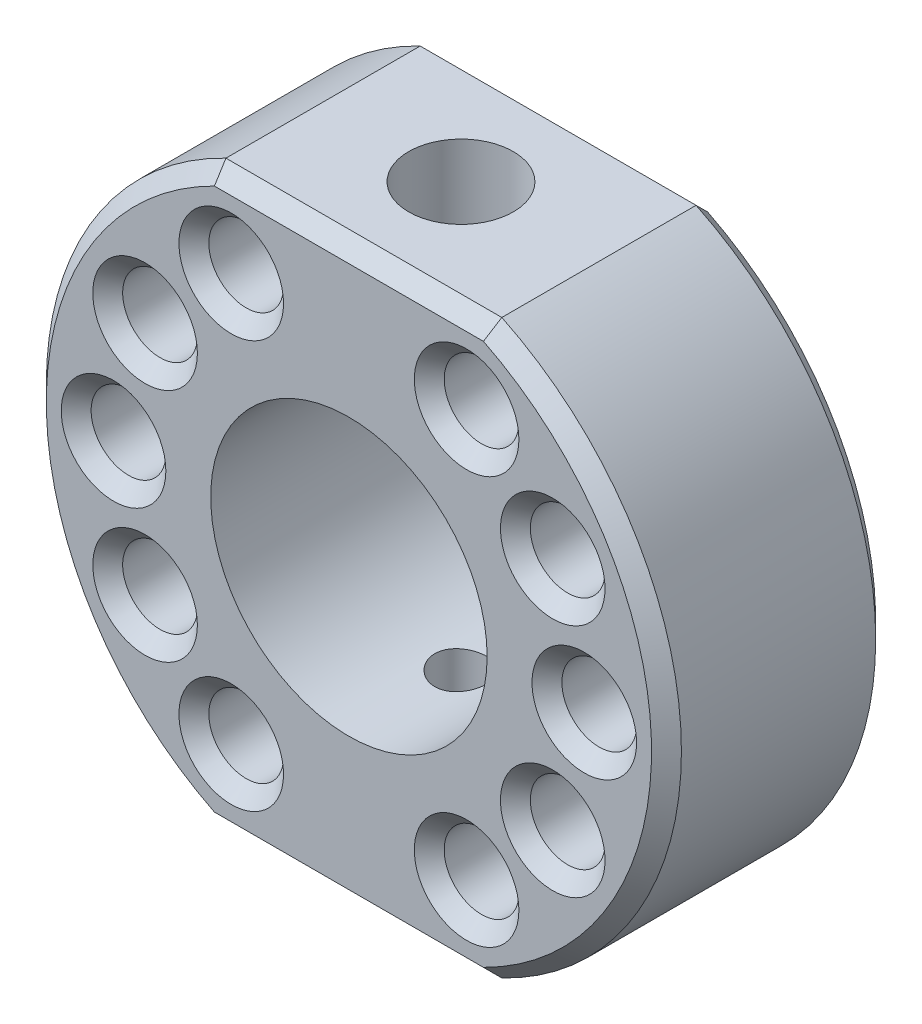
from build123d import *

# Parameters (mm, degrees)
SKETCH_1_R          = 21.25
SKETCH_1_R_2        = 9.25
SKETCH_1_R_3        = 2.5
EXTRUDE_1_DEPTH     = 15
CUT_EXTRUDE_START   = -15
CUT_EXTRUDE_1_DEPTH = 15
SKETCH_3_R          = 1.75
CUT_EXTRUDE_2_DEPTH = 47.280726062
CHAMFER_1_SIZE      = 1
CHAMFER_2_SIZE      = 1
SKETCH_4_R          = 3.5
CUT_EXTRUDE_3_DEPTH = 5


# Read off the part's stored shape, not the designer's step: ｶｯﾄ - 押し出し1
with BuildPart() as part:
    # ｽｹｯﾁ1 → ﾎﾞｽ - 押し出し1 (new body)
    with BuildSketch(Plane.XY):
        Circle(SKETCH_1_R)
        Circle(SKETCH_1_R_2, mode=Mode.SUBTRACT)
        with Locations((15.75, 0)):
            Circle(SKETCH_1_R_3, mode=Mode.SUBTRACT)
        with Locations((13.63990011, -7.875)):
            Circle(SKETCH_1_R_3, mode=Mode.SUBTRACT)
        with Locations((7.875, -13.63990011)):
            Circle(SKETCH_1_R_3, mode=Mode.SUBTRACT)
        with Locations(Location((7.875, 13.63990011, 0), (0, 0, 180))):
            Circle(SKETCH_1_R_3, mode=Mode.SUBTRACT)
        with Locations(Location((13.63990011, 7.875, 0), (0, 0, 180))):
            Circle(SKETCH_1_R_3, mode=Mode.SUBTRACT)
        with Locations(Location((-7.875, -13.63990011, 0), (0, 0, 180))):
            Circle(SKETCH_1_R_3, mode=Mode.SUBTRACT)
        with Locations(Location((-13.63990011, -7.875, 0), (0, 0, 180))):
            Circle(SKETCH_1_R_3, mode=Mode.SUBTRACT)
        with Locations(Location((-15.75, 0, 0), (0, 0, 180))):
            Circle(SKETCH_1_R_3, mode=Mode.SUBTRACT)
        with Locations((-13.63990011, 7.875)):
            Circle(SKETCH_1_R_3, mode=Mode.SUBTRACT)
        with Locations((-7.875, 13.63990011)):
            Circle(SKETCH_1_R_3, mode=Mode.SUBTRACT)
    extrude(amount=EXTRUDE_1_DEPTH)

    # ｶｯﾄ - 押し出し1 outline → ｶｯﾄ - 押し出し1 (cut)
    with BuildSketch(Plane.XY.offset(15).offset(CUT_EXTRUDE_START)):
        with BuildLine():
            Line((-9.231832093, 19.13990011), (9.231832093, 19.13990011))
            ThreePointArc((9.231832093, 19.13990011), (0, 21.25), (-9.231832093, 19.13990011))
        make_face()
        with BuildLine():
            Line((9.231832093, -19.13990011), (-9.231832093, -19.13990011))
            ThreePointArc((-9.231832093, -19.13990011), (0, -21.25), (9.231832093, -19.13990011))
        make_face()
    extrude(amount=CUT_EXTRUDE_1_DEPTH, mode=Mode.SUBTRACT)

    # ｽｹｯﾁ3 → ｶｯﾄ - 押し出し2 (cut, through all)
    with BuildSketch(Plane(origin=(0, 19.13990011, 0), x_dir=(1, 0, 0), z_dir=(0, 1, 0))):
        with Locations(Location((0, -7.5, 0), (0, 0, 270))):
            Circle(SKETCH_3_R)
    extrude(amount=-CUT_EXTRUDE_2_DEPTH, mode=Mode.SUBTRACT)

    # 面取り1
    chamfer_1_edges = [part.edges().sort_by_distance(p)[0] for p in [
        (10.375, 13.63990011, 0),
        (10.375, 13.63990011, 15),
        (11.13990011, -7.875, 0),
        (11.13990011, -7.875, 15),
        (5.375, -13.63990011, 0),
        (5.375, -13.63990011, 15),
        (16.13990011, 7.875, 0),
        (16.13990011, 7.875, 15),
        (-5.375, -13.63990011, 0),
        (-5.375, -13.63990011, 15),
        (-11.13990011, -7.875, 0),
        (-11.13990011, -7.875, 15),
        (-13.25, 0, 0),
        (-13.25, 0, 15),
        (-16.13990011, 7.875, 0),
        (-16.13990011, 7.875, 15),
        (-10.375, 13.63990011, 0),
        (-10.375, 13.63990011, 15),
        (13.25, 0, 0),
        (13.25, 0, 15),
    ]]
    chamfer(chamfer_1_edges, length=CHAMFER_1_SIZE)

    # 面取り2
    chamfer_2_edges = [part.edges().sort_by_distance(p)[0] for p in [
        (-21.25, 0, 15),
        (21.25, 0, 15),
        (-21.25, 0, 0),
        (21.25, 0, 0),
        (0, 19.13990011, 0),
        (0, -19.13990011, 0),
        (0, -19.13990011, 15),
        (0, 19.13990011, 15),
    ]]
    chamfer(chamfer_2_edges, length=CHAMFER_2_SIZE)

    # ｽｹｯﾁ4 → ｶｯﾄ - 押し出し3 (cut)
    with BuildSketch(Plane(origin=(0, 19.13990011, 0), x_dir=(1, 0, 0), z_dir=(0, 1, 0))):
        with Locations(Location((0, -7.5, 0), (0, 0, 270))):
            Circle(SKETCH_4_R)
    extrude(amount=-CUT_EXTRUDE_3_DEPTH, mode=Mode.SUBTRACT)


solid = part.part
